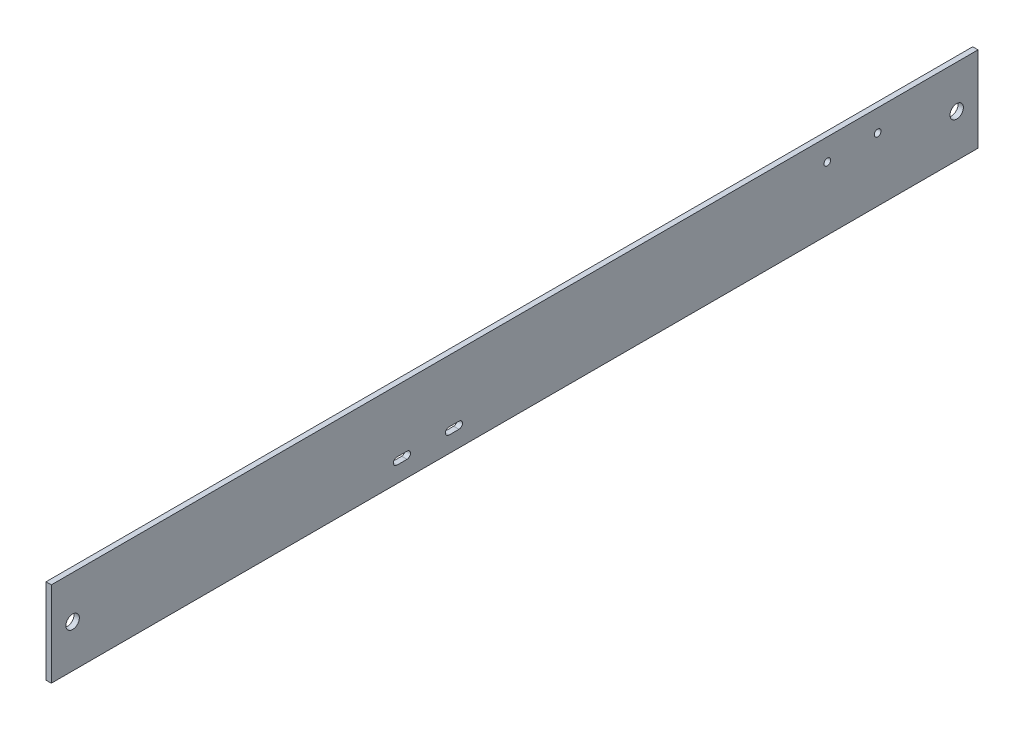
from build123d import *

# Parameters (mm, degrees)
SKETCH1_W           = 552.45
SKETCH1_H           = 50.8
SKETCH1_R           = 4
SKETCH1_R_2         = 2
BOSS_EXTRUDE2_DEPTH = 3.175


with BuildPart() as part:
    # Sketch1 → Boss-Extrude2 (new body)
    with BuildSketch(Plane(origin=(0, 0, 0), x_dir=(0, 0, -1), z_dir=(1, 0, 0))):
        with Locations((276.225, 25.4)):
            Rectangle(SKETCH1_W, SKETCH1_H)
        with Locations((12.7, 25.4)):
            Circle(SKETCH1_R, mode=Mode.SUBTRACT)
        with Locations((539.75, 25.4)):
            Circle(SKETCH1_R, mode=Mode.SUBTRACT)
        with Locations((462.625, 37.8)):
            Circle(SKETCH1_R_2, mode=Mode.SUBTRACT)
        with Locations((492.625, 37.8)):
            Circle(SKETCH1_R_2, mode=Mode.SUBTRACT)
        with BuildLine():
            Line((206.025, 13.8), (212.025, 13.8))
            ThreePointArc((212.025, 13.8), (214.125, 11.7), (212.025, 9.6))
            Line((212.025, 9.6), (206.025, 9.6))
            ThreePointArc((206.025, 9.6), (203.925, 11.7), (206.025, 13.8))
        make_face(mode=Mode.SUBTRACT)
        with BuildLine():
            Line((237.025, 13.8), (243.025, 13.8))
            ThreePointArc((243.025, 13.8), (245.125, 11.7), (243.025, 9.6))
            Line((243.025, 9.6), (237.025, 9.6))
            ThreePointArc((237.025, 9.6), (234.925, 11.7), (237.025, 13.8))
        make_face(mode=Mode.SUBTRACT)
    extrude(amount=BOSS_EXTRUDE2_DEPTH)


solid = part.part
